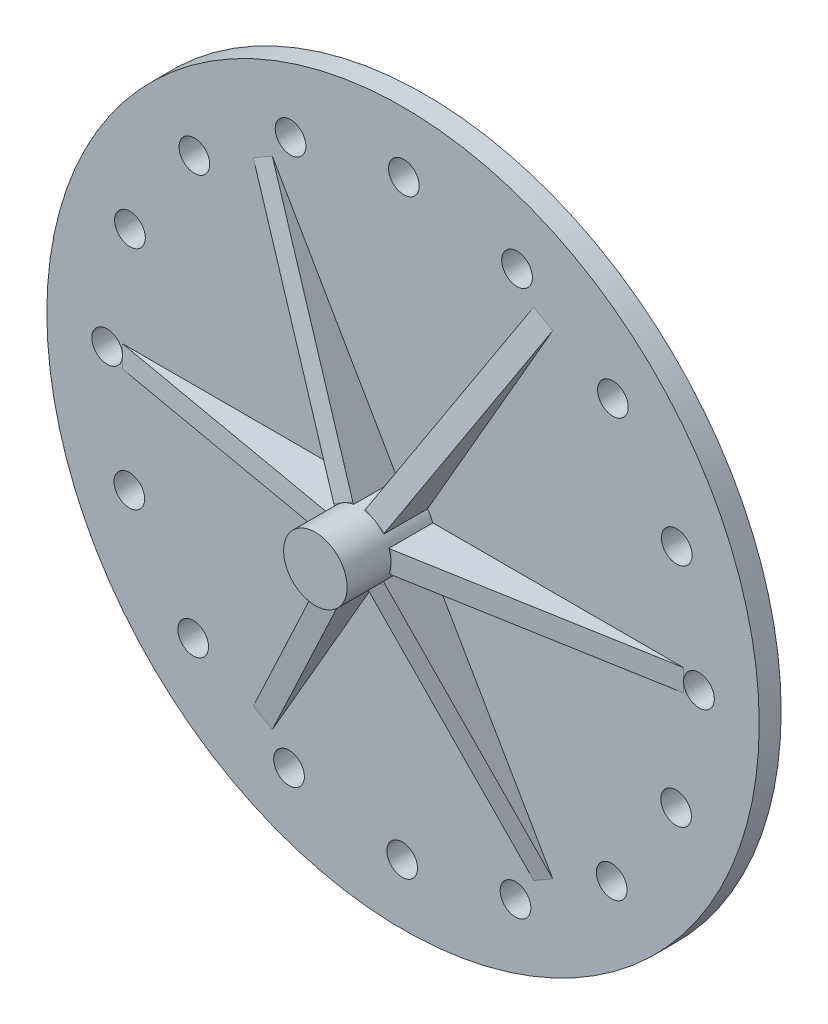
from build123d import *

# Parameters (mm, degrees)
SKETCH1_R           = 162.5
BOSS_EXTRUDE1_DEPTH = 10
SKETCH2_R           = 7
CUT_EXTRUDE1_DEPTH  = 231.027172308
CIRPATTERN1_COUNT   = 16
SKETCH3_R           = 14.5
BOSS_EXTRUDE2_DEPTH = 20
RIB1_START          = -5
RIB1_DEPTH          = 10
CIRPATTERN2_COUNT   = 6
SKETCH6_R           = 14.5
BOSS_EXTRUDE3_DEPTH = 20


with BuildPart() as part:
    # Sketch1 → Boss-Extrude1 (new body)
    with BuildSketch(Plane.XY):
        Circle(SKETCH1_R)
    extrude(amount=BOSS_EXTRUDE1_DEPTH)

    # Sketch2 → Cut-Extrude1 (cut, through all)
    with BuildSketch(Plane.XY.offset(10)):
        with Locations((-51.315180135, 124.866938329)):
            Circle(SKETCH2_R)
    cut_extrude1 = extrude(amount=-CUT_EXTRUDE1_DEPTH, mode=Mode.SUBTRACT)

    # CirPattern1: Cut-Extrude1 ×16 about axis
    cirpattern1_axis = Axis((0, 0, 0), (0, 0, 1))
    for i in range(1, CIRPATTERN1_COUNT):
        add(cut_extrude1.rotate(cirpattern1_axis, i * 360 / CIRPATTERN1_COUNT), mode=Mode.SUBTRACT)

    # Sketch3 → Boss-Extrude2 (add)
    with BuildSketch(Plane.XY.offset(10)):
        Circle(SKETCH3_R)
    extrude(amount=BOSS_EXTRUDE2_DEPTH)

    # Rib1: read off the stored shape, not the designer's step
    # Rib1 outline → Rib1 (add)
    with BuildSketch(Plane(origin=(0, 0, 0), x_dir=(1, 0, 0), z_dir=(0, 1, 0)).offset(RIB1_START)):
        Polygon((-14.5, -30), (-13.610657589, -30), (-13.610657589, -10), (-127.925636392, -10), align=None)
    rib1 = extrude(amount=RIB1_DEPTH)

    # CirPattern2: Rib1 ×6 about axis
    cirpattern2_axis = Axis((0, 0, 0), (0, 0, 1))
    for i in range(1, CIRPATTERN2_COUNT):
        add(rib1.rotate(cirpattern2_axis, i * 360 / CIRPATTERN2_COUNT))

    # Sketch6 → Boss-Extrude3 (add)
    with BuildSketch(Plane.XY.offset(30)):
        Circle(SKETCH6_R)
    extrude(amount=BOSS_EXTRUDE3_DEPTH)


solid = part.part
